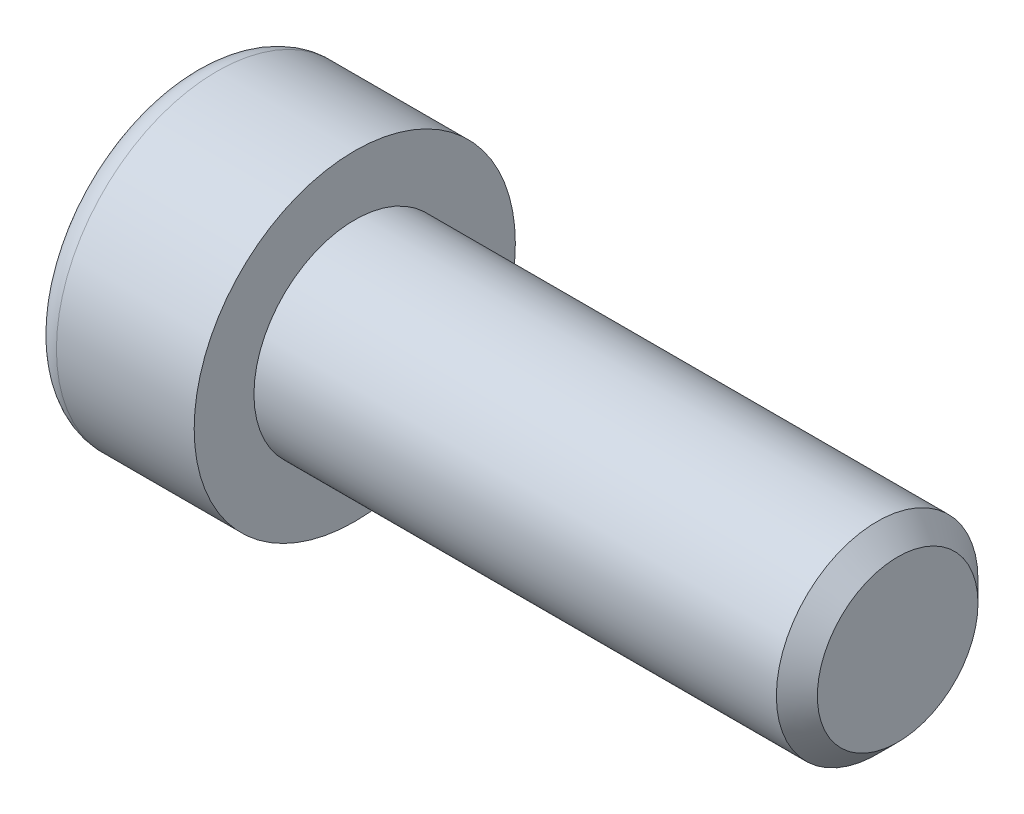
from build123d import *

# Parameters (mm, degrees)
ENL_V_MAT_EXTRU_1_DEPTH = 3
CONG_1_R                = 0.5


with BuildPart() as part:
    # Esquisse1 → Révolution1 (revolve)
    with BuildSketch(Plane.XY):
        with BuildLine():
            Line((-384.724114558, 346.45173931), (-405.451180174, 346.45173931))
            Line((-405.451180174, 346.45173931), (-405.451180174, 348.823102604))
            Line((-405.451180174, 348.823102604), (-410.916586931, 348.823102604))
            ThreePointArc((-410.916586931, 348.823102604), (-411.623693712, 348.530209385), (-411.916586931, 347.823102604))
            Line((-411.916586931, 347.823102604), (-411.916586931, 342.45173931))
            Line((-411.916586931, 342.45173931), (-383.911125607, 342.45173931))
            Line((-383.911125607, 342.45173931), (-383.911125607, 345.638750359))
            Line((-383.911125607, 345.638750359), (-384.724114558, 346.45173931))
        make_face()
    revolve(axis=Axis((-383.911125607, 342.45173931, 0), (-1, 0, 0)))

    # Esquisse2 → Enlèv. mat.-Extru.1 (cut)
    with BuildSketch(Plane.ZY.offset(411.916586931)):
        Polygon((-3.269339183, 343.387000996), (-2.44462997, 340.088039367), (0.824709212, 339.152777681), (3.269339183, 341.516477624), (2.44462997, 344.815439253), (-0.824709212, 345.750700939), align=None)
    extrude(amount=-ENL_V_MAT_EXTRU_1_DEPTH, mode=Mode.SUBTRACT)

    # Congé1
    cong_1_edges = [part.edges().sort_by_distance(p)[0] for p in [
        (-408.916586931, 345.283070096, 0.809960379),
        (-408.916586931, 343.165958439, 2.856984577),
        (-408.916586931, 340.334627653, 2.047024198),
        (-408.916586931, 339.620408524, -0.809960379),
        (-408.916586931, 341.737520181, -2.856984577),
        (-408.916586931, 344.568850967, -2.047024198),
    ]]
    fillet(cong_1_edges, radius=CONG_1_R)


solid = part.part
